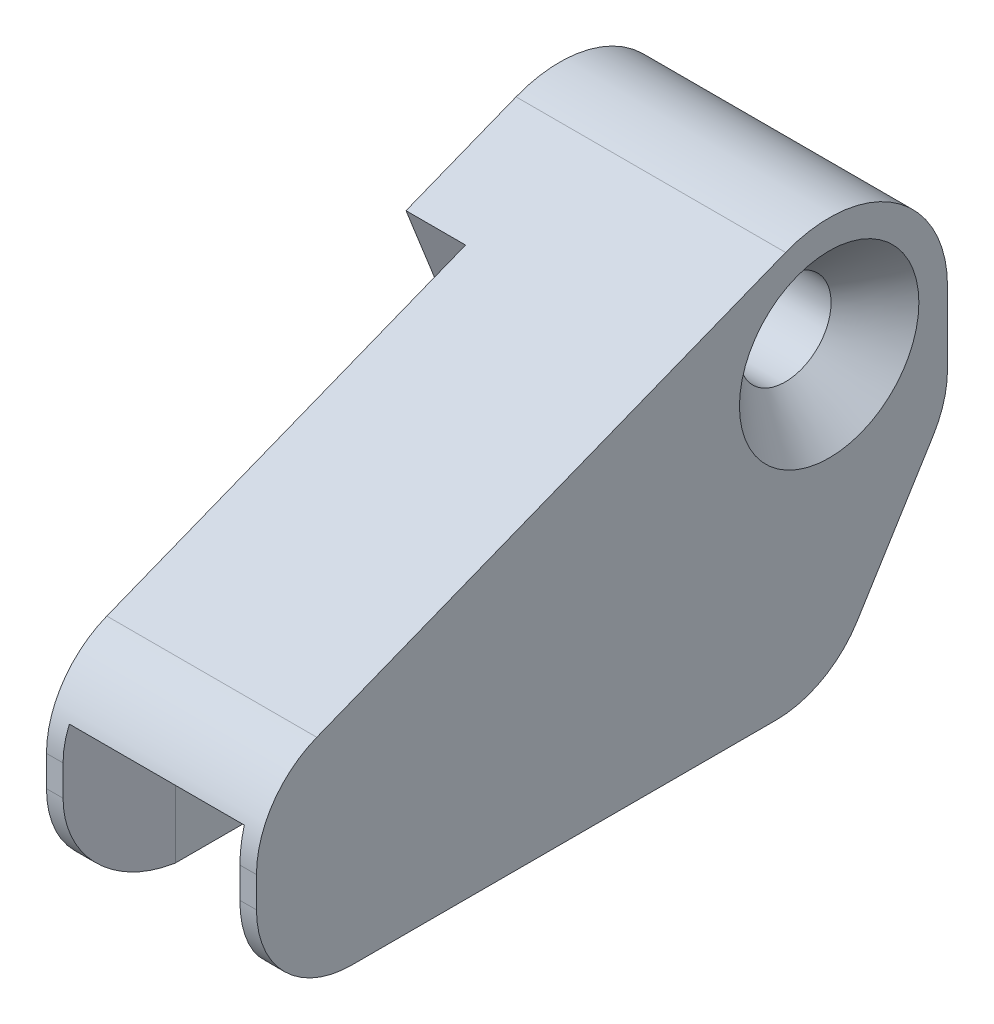
from build123d import *
from OCP.BRepFilletAPI import BRepFilletAPI_MakeChamfer

# Parameters (mm, degrees)
SKETCH1_R                                       = 2.2
BOSS_EXTRUDE1_DEPTH                             = 11
CUT_EXTRUDE1_REACH                              = 42.774
SKETCH2_W                                       = 7.5
SKETCH2_H                                       = 8.25
CHAMFER3_SIZE                                   = 5
CHAMFER3_SIZE2                                  = 0.881634904
FILLET1_R                                       = 5
CHAMFER1_SIZE                                   = 2.212207332
CHAMFER1_SIZE_2                                 = 4
CSK_FOR_M4_FLAT_HEAD_MACHINE_SCREW1_D           = 4.8
CSK_FOR_M4_FLAT_HEAD_MACHINE_SCREW1_CSINK_D     = 9.4
CSK_FOR_M4_FLAT_HEAD_MACHINE_SCREW1_CSINK_ANGLE = 90
BOSS_EXTRUDE2_START                             = 3.12
SKETCH6_R                                       = 2.4
BOSS_EXTRUDE2_DEPTH                             = 3.12


with BuildPart() as part:
    # Sketch1 → Boss-Extrude1 (new body)
    with BuildSketch(Plane(origin=(0, 0, 0), x_dir=(0, 0, -1), z_dir=(1, 0, 0))):
        with BuildLine():
            Line((-30, -15.2), (-30, -5.2))
            Line((-30, -5.2), (-2.280651189, 5.765295322))
            ThreePointArc((-2.280651189, 5.765295322), (3.485682331, 5.12737932), (6.2, 0))
            Line((6.2, 0), (6.2, -5.2))
            Line((6.2, -5.2), (0, -15.2))
            Line((0, -15.2), (-30, -15.2))
        make_face()
        Circle(SKETCH1_R, mode=Mode.SUBTRACT)
    extrude(amount=BOSS_EXTRUDE1_DEPTH)

    # Cut-Extrude1: up to this plane
    cut_extrude1_end = Plane(origin=(11, -5.2, -6.2), z_dir=(0, 0.5269396688616753, 0.8499026917123795))
    # Sketch2 → Cut-Extrude1 (cut, up to the surface)
    with BuildSketch(Plane.XY.offset(30), mode=Mode.PRIVATE) as cut_extrude1_sk1:
        with Locations((5.5, -11.075)):
            Rectangle(SKETCH2_W, SKETCH2_H)
    cut_extrude1_tool1 = split(extrude(cut_extrude1_sk1.sketch, amount=-CUT_EXTRUDE1_REACH, mode=Mode.PRIVATE), bisect_by=cut_extrude1_end, keep=Keep.BOTH, mode=Mode.PRIVATE)
    add(cut_extrude1_tool1.solids().sort_by_distance((5.5, -11.075, 30))[0], mode=Mode.SUBTRACT)

    # Chamfer3: one chamfer whose edges measure the first distance from different faces: ONE call of the kernel's chamfer builder (chamfer() names one face for all edges)
    chamfer3_edges_1 = [part.edges().sort_by_distance(p)[0] for p in [
        (1.75, -11.075, 30),
    ]]
    chamfer3_side_1 = [part.faces().sort_by_distance(p)[0] for p in [
        (1.75, -10.966989173, 13.687766644),
    ]]
    chamfer3_edges_2 = [part.edges().sort_by_distance(p)[0] for p in [
        (9.25, -11.075, 30),
    ]]
    chamfer3_side_2 = [part.faces().sort_by_distance(p)[0] for p in [
        (9.25, -10.966989173, 13.687766644),
    ]]
    chamfer3 = BRepFilletAPI_MakeChamfer(part.part.solid().wrapped)
    for e in chamfer3_edges_1:
        chamfer3.Add(CHAMFER3_SIZE, CHAMFER3_SIZE2, e.wrapped, chamfer3_side_1[0].wrapped)  # the first distance lies on this face
    for e in chamfer3_edges_2:
        chamfer3.Add(CHAMFER3_SIZE, CHAMFER3_SIZE2, e.wrapped, chamfer3_side_2[0].wrapped)  # the first distance lies on this face
    add(Compound.cast(chamfer3.Shape()), mode=Mode.REPLACE)

    # Fillet1
    # the kernel refuses this fillet: 5 mm, written as the material it takes off along each edge
    with BuildSketch(Plane(origin=(-12.5, -15.2, 30), x_dir=(0, 1, 0), z_dir=(1, 0, 0)), Plane(origin=(-2.368365096, -15.2, 30), x_dir=(0, 1, 0), z_dir=(1, 0, 0))) as fillet1_piece_1:
        with BuildLine():
            CenterArc((FILLET1_R, -FILLET1_R), FILLET1_R, 90, 90)
            Line((0, -FILLET1_R), (0, 0))
            Line((0, 0), (FILLET1_R, 0))
        make_face()
    extrude(amount=25.868365096, mode=Mode.SUBTRACT)
    with BuildSketch(Plane(origin=(-3.560590452, -5.2, -6.2), x_dir=(0, -0.8499026917123794, 0.5269396688616755), z_dir=(1, 0, 0))) as fillet1_piece_2:
        with BuildLine():
            CenterArc((FILLET1_R * 0.28484723614, -FILLET1_R), FILLET1_R, 90, 31.798912824)
            Line((-FILLET1_R * 0.242092432722, -FILLET1_R * 0.150097308288), (0, 0))
            Line((0, 0), (FILLET1_R * 0.28484723614, 0))
        make_face()
    extrude(amount=18.121180903, mode=Mode.SUBTRACT)
    with BuildSketch(Plane(origin=(-6.95756608, -15.2, 0), x_dir=(0, 0.8499026917123792, -0.5269396688616758), z_dir=(1, 0, 0)), Plane(origin=(2.29243392, -15.2, 0), x_dir=(0, 0.8499026917123792, -0.5269396688616758), z_dir=(1, 0, 0))) as fillet1_piece_3:
        with BuildLine():
            CenterArc((FILLET1_R * 0.556605286407, FILLET1_R), FILLET1_R, 211.798912824, 58.201087176)
            Line((-FILLET1_R * 0.293297405306, FILLET1_R * 0.473060331138), (0, 0))
            Line((0, 0), (FILLET1_R * 0.556605286407, 0))
        make_face()
    extrude(amount=15.66513216, mode=Mode.SUBTRACT)
    with BuildSketch(Plane(origin=(-8.497719093, -5.2, 30), x_dir=(0, -1, 0), z_dir=(1, 0, 0))) as fillet1_piece_4:
        with BuildLine():
            CenterArc((FILLET1_R * 0.679817527413, FILLET1_R), FILLET1_R, 201.582895238, 68.417104762)
            Line((-FILLET1_R * 0.250068814892, FILLET1_R * 0.632153034001), (0, 0))
            Line((0, 0), (FILLET1_R * 0.679817527413, 0))
        make_face()
    extrude(amount=27.995438185, mode=Mode.SUBTRACT)

    # Chamfer1
    # the kernel refuses this chamfer: 4, 2.212207332 mm, written as the material it takes off along each edge
    with BuildSketch(Plane(origin=(1.75, -6.95, -5.115), x_dir=(0, -0.04228471314336273, 0.9991056015428917), z_dir=(1, 0, 0))) as chamfer1_piece_1:
        Polygon((CHAMFER1_SIZE * 0.999105601467, -CHAMFER1_SIZE * 0.0422847131402), (-CHAMFER1_SIZE_2 * 0.562406266354, -CHAMFER1_SIZE_2 * 0.826861047315), (0, 0), align=None)
    extrude(amount=7.5, mode=Mode.SUBTRACT)

    # CSK for M4 Flat Head Machine Screw1 (through all)
    with Locations(Plane(origin=(11, 0, 0), x_dir=(0, 0, -1), z_dir=(1, 0, 0))):
        with Locations((0, 0)):
            CounterSinkHole(CSK_FOR_M4_FLAT_HEAD_MACHINE_SCREW1_D / 2, CSK_FOR_M4_FLAT_HEAD_MACHINE_SCREW1_CSINK_D / 2, counter_sink_angle=CSK_FOR_M4_FLAT_HEAD_MACHINE_SCREW1_CSINK_ANGLE)

    # Sketch6 → Boss-Extrude2 (add)
    with BuildSketch(Plane.ZY.offset(BOSS_EXTRUDE2_START)):
        with BuildLine():
            Line((8.045946511, 3.484644133), (5.765295322, -2.280651189))
            ThreePointArc((5.765295322, -2.280651189), (-5.689343339, -2.464015497), (2.280651189, 5.765295322))
            Line((2.280651189, 5.765295322), (8.045946511, 3.484644133))
        make_face()
        with Locations(Location((0, 0, 0), (0, 0, 180))):
            Circle(SKETCH6_R, mode=Mode.SUBTRACT)
    extrude(amount=-BOSS_EXTRUDE2_DEPTH)


solid = part.part
